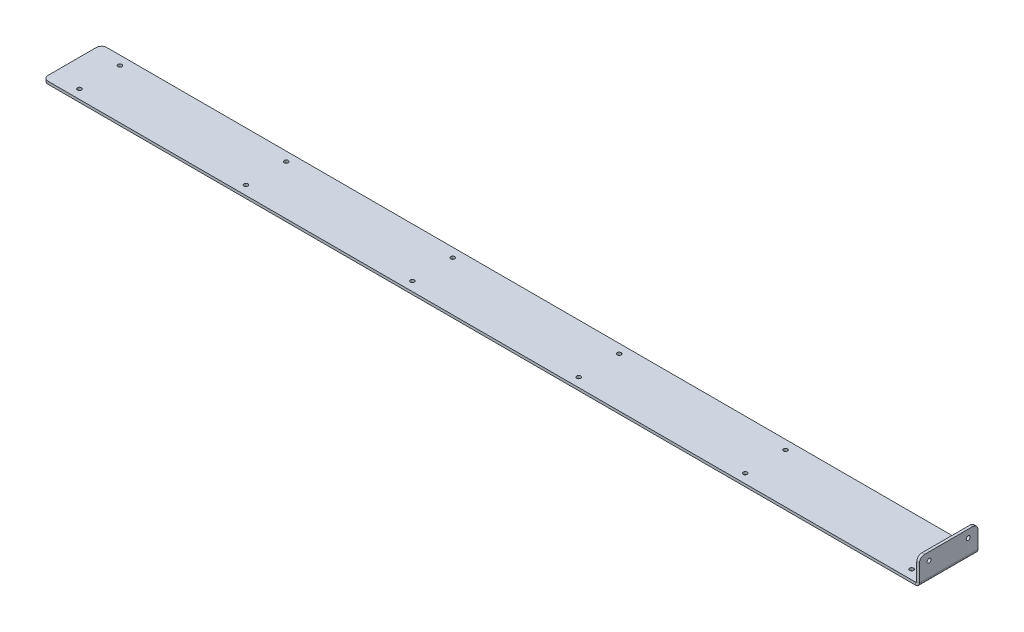
from build123d import *

# Parameters (mm, degrees)
SKETCH1_W                    = 1063.92345
SKETCH1_H                    = 71.4375
BASE_FLANGE1_DEPTH           = 3.2639
EDGE_FLANGE2_DEPTH           = 71.4375
F_10_0_1935_DIAMETER_HOLE1_D = 4.9149
LPATTERN1_COUNT              = 6
LPATTERN1_PITCH              = 202.8825
F_10_0_1935_DIAMETER_HOLE2_D = 4.9149
FILLET1_R                    = 6.35


# Sheet-metal steps are written as plain solids
with BuildPart() as part:
    # Sketch1 → Base-Flange1 (new body)
    with BuildSketch(Plane(origin=(0, 0, 0), x_dir=(1, 0, 0), z_dir=(0, 1, 0))):
        with Locations((-531.961725, 0)):
            Rectangle(SKETCH1_W, SKETCH1_H)
    extrude(amount=-BASE_FLANGE1_DEPTH)

    # Edge-Flange2 section (across the edge) → Edge-Flange2 (add)
    with BuildSketch(Plane(origin=(1.27, 0, 35.71875), x_dir=(-1, 0, 0), z_dir=(0, 0, -1))):
        with BuildLine():
            Line((-3.2639, 1.27), (-3.2639, 28.4861))
            Line((-3.2639, 28.4861), (0, 28.4861))
            Line((0, 28.4861), (0, 1.27))
            ThreePointArc((0, 1.27), (0.371974388, 0.371974388), (1.27, 0))
            Line((1.27, 0), (1.27, -3.2639))
            ThreePointArc((1.27, -3.2639), (-1.935951435, -1.935951435), (-3.2639, 1.27))
        make_face()
    extrude(amount=EDGE_FLANGE2_DEPTH)

    # #10 (0.1935) Diameter Hole1 (through all)
    with Locations(Plane(origin=(0, 0, 0), x_dir=(1, 0, 0), z_dir=(0, 1, 0))):
        with Locations((-16.1036, 24.60625), (-16.1036, -24.60625)):
            f_10_0_1935_diameter_hole1 = Hole(F_10_0_1935_DIAMETER_HOLE1_D / 2)

    # LPattern1: #10 (0.1935) Diameter Hole1 ×6
    with Locations(*[(-i * LPATTERN1_PITCH, 0, 0) for i in range(1, LPATTERN1_COUNT)]):
        add(f_10_0_1935_diameter_hole1, mode=Mode.SUBTRACT)

    # #10 (0.1935) Diameter Hole2 (through all)
    with Locations(Plane.ZY.offset(-1.27)):
        with Locations((-23.8125, 19.05), (23.8125, 19.05)):
            Hole(F_10_0_1935_DIAMETER_HOLE2_D / 2)

    # Fillet1
    fillet1_edges = [part.edges().sort_by_distance(p)[0] for p in [
        (2.90195, 28.4861, 35.71875),
        (2.90195, 28.4861, -35.71875),
        (-1063.92345, -1.63195, -35.71875),
        (-1063.92345, -1.63195, 35.71875),
    ]]
    fillet(fillet1_edges, radius=FILLET1_R)


solid = part.part
